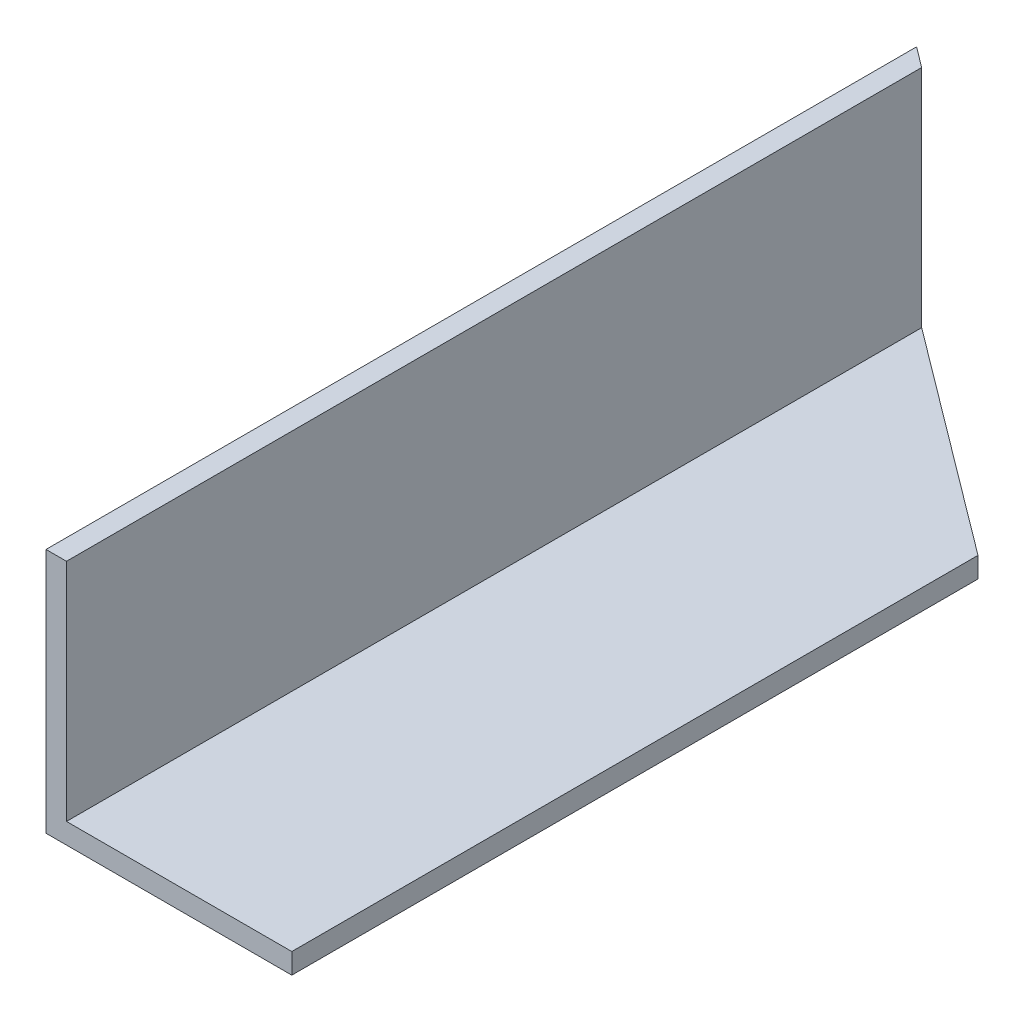
from build123d import *

# Parameters (mm, degrees)
SKETCH1_W           = 38.1
SKETCH1_H           = 38.1
BOSS_EXTRUDE1_DEPTH = 134.93774257
SKETCH2_W           = 34.925
SKETCH2_H           = 34.925
CUT_EXTRUDE1_DEPTH  = 134.93774257
CUT_EXTRUDE2_DEPTH  = 38.1


with BuildPart() as part:
    # Sketch1 → Boss-Extrude1 (new body)
    with BuildSketch(Plane.XY):
        with Locations((19.05, 19.05)):
            Rectangle(SKETCH1_W, SKETCH1_H)
    extrude(amount=BOSS_EXTRUDE1_DEPTH)

    # Sketch2 → Cut-Extrude1 (cut)
    with BuildSketch(Plane.XY.offset(134.93774257)):
        with Locations((20.6375, 20.6375)):
            Rectangle(SKETCH2_W, SKETCH2_H)
    extrude(amount=-CUT_EXTRUDE1_DEPTH, mode=Mode.SUBTRACT)

    # Sketch3 → Cut-Extrude2 (cut)
    with BuildSketch(Plane(origin=(0, 0, 0), x_dir=(-1, 0, 0), z_dir=(0, -1, 0))):
        Polygon((0, 0), (-38.1, 0), (-38.1, -28.575106348), align=None)
    extrude(amount=-CUT_EXTRUDE2_DEPTH, mode=Mode.SUBTRACT)


solid = part.part
